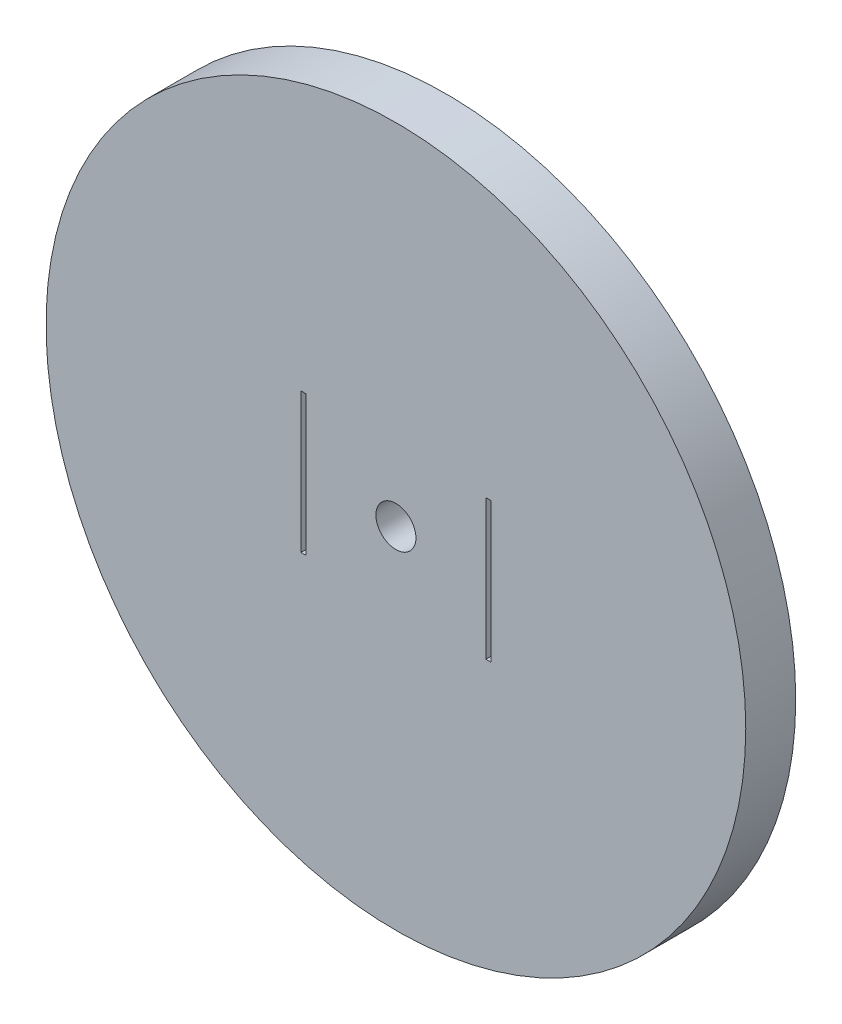
from build123d import *

# Parameters (mm, degrees)
SKETCH1_R           = 35
SKETCH1_R_2         = 2
SKETCH1_W           = 0.5
SKETCH1_H           = 14
BOSS_EXTRUDE1_DEPTH = 5


with BuildPart() as part:
    # Sketch1 → Boss-Extrude1 (new body)
    with BuildSketch(Plane.XY):
        Circle(SKETCH1_R)
        Circle(SKETCH1_R_2, mode=Mode.SUBTRACT)
        with Locations((-9.25, 0)):
            Rectangle(SKETCH1_W, SKETCH1_H, mode=Mode.SUBTRACT)
        with Locations((9.25, 0)):
            Rectangle(SKETCH1_W, SKETCH1_H, mode=Mode.SUBTRACT)
    extrude(amount=BOSS_EXTRUDE1_DEPTH)

    # Sketch3 → Revolve1 (revolve)
    with BuildSketch(Plane(origin=(0, 0, 0), x_dir=(1, 0, 0), z_dir=(0, 1, 0))):
        with BuildLine():
            Line((-28.35, 14.632072887), (-28.35, 0))
            Line((-28.35, 0), (-24, 0))
            Line((-24, 0), (-24, 18.982072887))
            ThreePointArc((-24, 18.982072887), (-27.075914498, 17.707987385), (-28.35, 14.632072887))
        make_face()
    revolve(axis=Axis((-24, 0, -14.632072887), (0, 0, 1)))


solid = part.part
